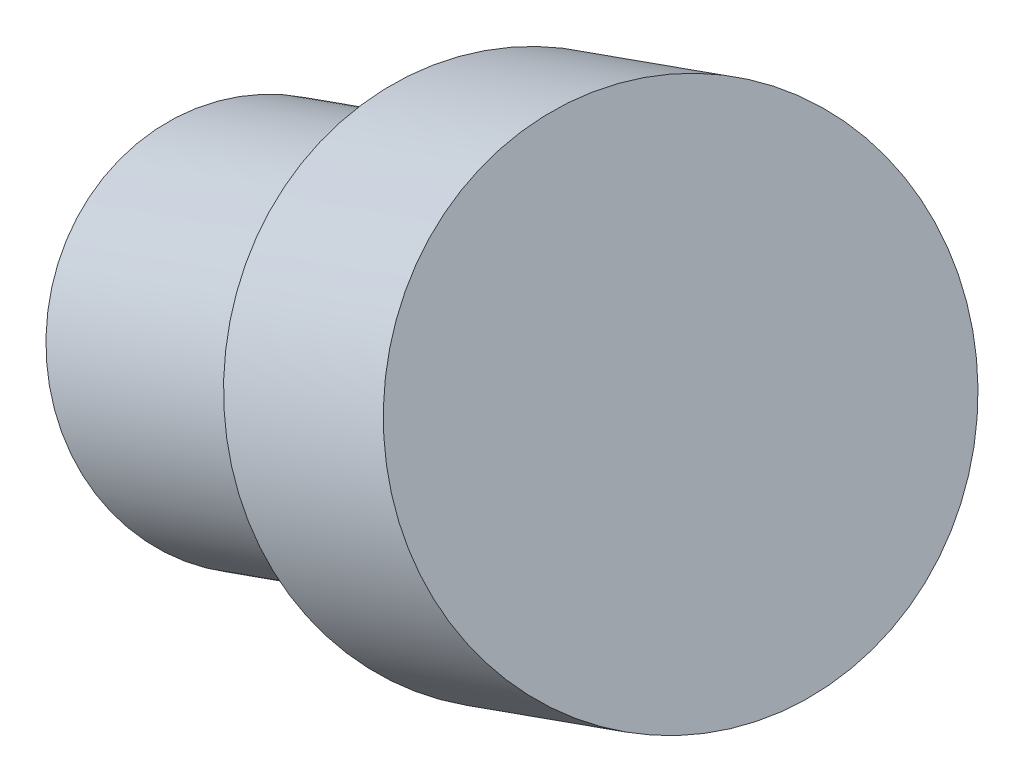
from build123d import *

# Parameters (mm, degrees)
SKETCH2_R             = 32.184938318
BOSS_EXTRUDE1_DEPTH   = 78
SKETCH3_R             = 44.452761075
BOSS_EXTRUDE2_DEPTH   = 48
BODY_MOVE_COPY2_ANGLE = 94.867085016


with BuildPart() as part:
    # Sketch2 → Boss-Extrude1 (new body)
    with BuildSketch(Plane(origin=(0, 0, 0), x_dir=(1, 0, 0), z_dir=(0, 1, 0))):
        Circle(SKETCH2_R)
    extrude(amount=BOSS_EXTRUDE1_DEPTH)

    # Sketch3 → Boss-Extrude2 (add)
    with BuildSketch(Plane(origin=(0, 78, 0), x_dir=(1, 0, 0), z_dir=(0, 1, 0))):
        Circle(SKETCH3_R)
    extrude(amount=BOSS_EXTRUDE2_DEPTH)


with BuildPart() as part_1:
    # Body-Move/Copy1: moved
    add(part.part.moved(Location((-72.960744445, 52.218831428, 0))))


with BuildPart() as part_2:
    # Body-Move/Copy2: moved
    add(part_1.part.moved(Location((0, 0, 0))).rotate(Axis((-95.551423715, 86.931599726, 17.334437881), (0.5628374693955368, 0.7047647269251498, -0.4318803801129975)), BODY_MOVE_COPY2_ANGLE))


solid = part_2.part
